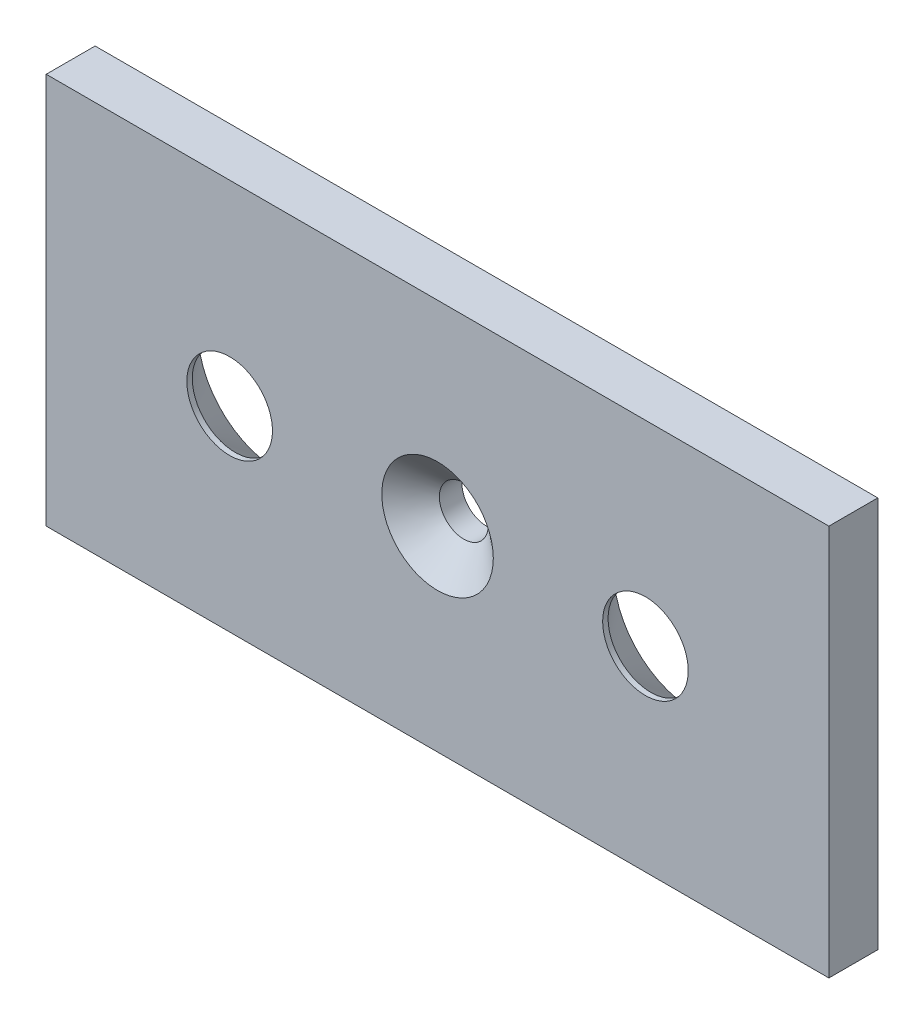
from build123d import *

# Parameters (mm, degrees)
SKETCH1_W                                         = 50.8
SKETCH1_H                                         = 25.4
BOSS_EXTRUDE1_DEPTH                               = 3.175
CSK_FOR_6_FLAT_HEAD_MACHINE_SCREW_100_D           = 3.175
CSK_FOR_6_FLAT_HEAD_MACHINE_SCREW_100_DEPTH       = 25.4
CSK_FOR_6_FLAT_HEAD_MACHINE_SCREW_100_CSINK_D     = 7.239
CSK_FOR_6_FLAT_HEAD_MACHINE_SCREW_100_CSINK_ANGLE = 100
CSK_FOR_6_FLAT_HEAD_MACHINE_SCREW_100_TIP         = 0.953866233


# Read off the part's stored shape, not the designer's step: CSK for #6 Flat Head Machine Screw (100)2
with BuildPart() as part:
    # Sketch1 → Boss-Extrude1 (new body)
    with BuildSketch(Plane.XY):
        with Locations((25.4, 12.7)):
            Rectangle(SKETCH1_W, SKETCH1_H)
    extrude(amount=BOSS_EXTRUDE1_DEPTH)

    # CSK for _6 Flat Head Machine Screw _100
    with Locations(Plane.XY.offset(3.175)):
        with Locations((25.4, 12.7)):
            CounterSinkHole(CSK_FOR_6_FLAT_HEAD_MACHINE_SCREW_100_D / 2, CSK_FOR_6_FLAT_HEAD_MACHINE_SCREW_100_CSINK_D / 2, depth=CSK_FOR_6_FLAT_HEAD_MACHINE_SCREW_100_DEPTH, counter_sink_angle=CSK_FOR_6_FLAT_HEAD_MACHINE_SCREW_100_CSINK_ANGLE)
            with Locations((0, 0, -(CSK_FOR_6_FLAT_HEAD_MACHINE_SCREW_100_DEPTH + CSK_FOR_6_FLAT_HEAD_MACHINE_SCREW_100_TIP / 2))):  # 118° drill point
                Cone(0, CSK_FOR_6_FLAT_HEAD_MACHINE_SCREW_100_D / 2, CSK_FOR_6_FLAT_HEAD_MACHINE_SCREW_100_TIP, mode=Mode.SUBTRACT)

    # CSK for _6 Flat Head Machine Screw _ 2 o → CSK for _6 Flat Head Machine Screw _ 2 (revolve, cut)
    with BuildSketch(Plane(origin=(11.90625, 12.7, 0), x_dir=(1, 0, 0), z_dir=(0, -1, 0))):
        Polygon((2.778125, 2.823320423), (2.778125, 3.175), (0, 3.175), (0, 0), (5.2324, 0), align=None)
    revolve(axis=Axis((11.90625, 12.7, 0), (0, 0, 1)), mode=Mode.SUBTRACT)

    # CSK for _6 Flat Head Machine Screw _ 3 → CSK for _6 Flat Head Machine Screw _ 2 2 (revolve, cut)
    with BuildSketch(Plane(origin=(38.89375, 12.7, 0), x_dir=(1, 0, 0), z_dir=(0, -1, 0))):
        Polygon((2.778125, 2.823320423), (2.778125, 3.175), (0, 3.175), (0, 0), (5.2324, 0), align=None)
    revolve(axis=Axis((38.89375, 12.7, 0), (0, 0, 1)), mode=Mode.SUBTRACT)


solid = part.part
